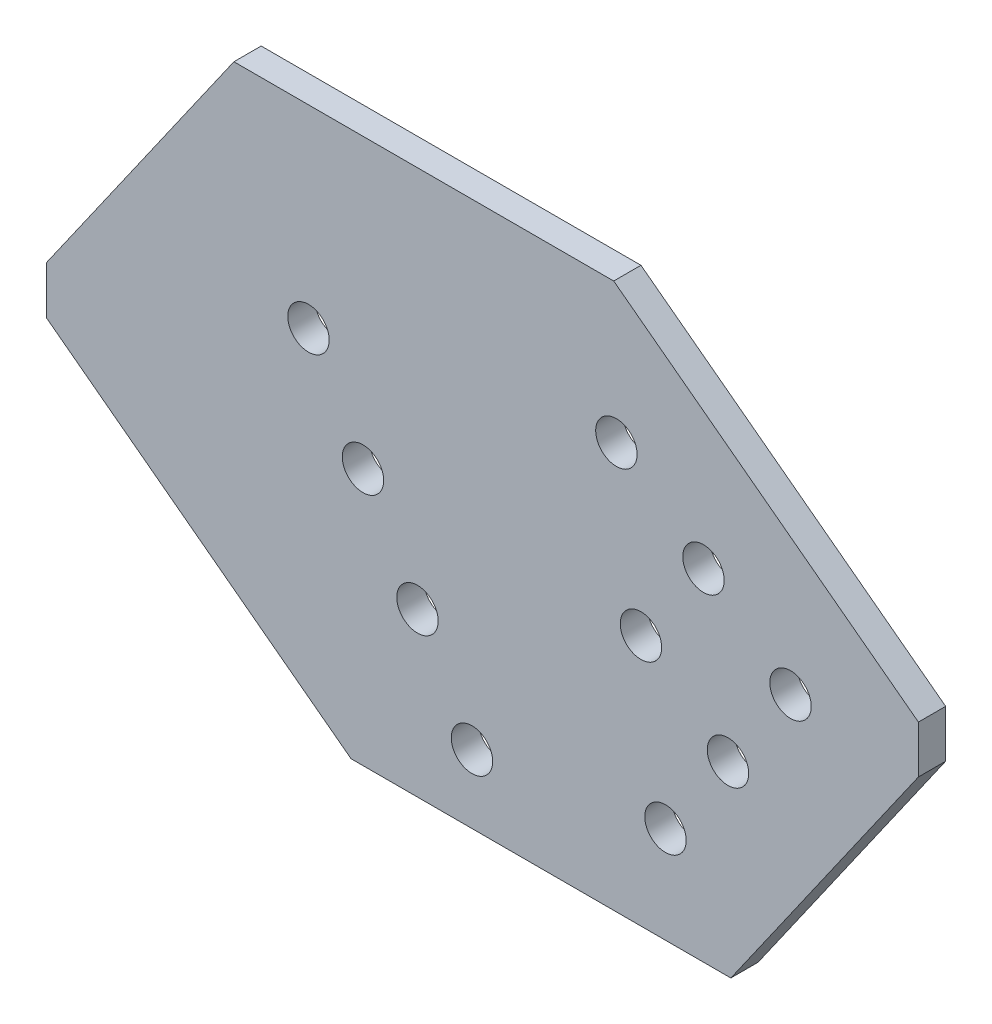
from build123d import *

# Parameters (mm, degrees)
SKETCH1_W           = 101.6
SKETCH1_H           = 63.5
BOSS_EXTRUDE1_DEPTH = 3.175
CUT_EXTRUDE1_DEPTH  = 120.85362166
CUT_EXTRUDE2_DEPTH  = 120.85362166
SKETCH4_R           = 2.413
CUT_EXTRUDE3_DEPTH  = 120.85362166
SKETCH5_R           = 2.413
CUT_EXTRUDE4_DEPTH  = 120.85362166


with BuildPart() as part:
    # Sketch1 → Boss-Extrude1 (new body)
    with BuildSketch(Plane.XY):
        with Locations((50.8, 31.75)):
            Rectangle(SKETCH1_W, SKETCH1_H)
    extrude(amount=BOSS_EXTRUDE1_DEPTH)

    # Sketch2 → Cut-Extrude1 (cut, through all)
    with BuildSketch(Plane.XY.offset(3.175)):
        Polygon((101.6, 31.209692887), (79.746737775, 0), (101.6, 0), align=None)
        Polygon((101.6, 36.749322221), (66.100651578, 63.5), (101.6, 63.5), align=None)
    extrude(amount=-CUT_EXTRUDE1_DEPTH, mode=Mode.SUBTRACT)

    # Sketch3 → Cut-Extrude2 (cut, through all)
    with BuildSketch(Plane.XY.offset(3.175)):
        Polygon((21.853262225, 63.5), (0, 32.290307113), (0, 63.5), align=None)
        Polygon((0, 0), (0, 26.750677779), (35.499348422, 0), align=None)
    extrude(amount=-CUT_EXTRUDE2_DEPTH, mode=Mode.SUBTRACT)

    # Sketch4 → Cut-Extrude3 (cut, through all)
    with BuildSketch(Plane.XY.offset(3.175)):
        with Locations((49.59148185, 7.959897775)):
            Circle(SKETCH4_R)
        with Locations((43.24148185, 18.958420404)):
            Circle(SKETCH4_R)
        with Locations((36.89148185, 29.956943032)):
            Circle(SKETCH4_R)
        with Locations((30.54148185, 40.95546566)):
            Circle(SKETCH4_R)
    extrude(amount=-CUT_EXTRUDE3_DEPTH, mode=Mode.SUBTRACT)

    # Sketch5 → Cut-Extrude4 (cut, through all)
    with BuildSketch(Plane.XY.offset(3.175)):
        with Locations((86.701417617, 32.074086458)):
            Circle(SKETCH5_R)
        with Locations((76.558746639, 39.717137252)):
            Circle(SKETCH5_R)
        with Locations((66.416075662, 47.360188046)):
            Circle(SKETCH5_R)
        with Locations((69.274325898, 29.31390629)):
            Circle(SKETCH5_R)
        with Locations((79.416996875, 21.670855495)):
            Circle(SKETCH5_R)
        with Locations((72.132576133, 11.267624533)):
            Circle(SKETCH5_R)
    extrude(amount=-CUT_EXTRUDE4_DEPTH, mode=Mode.SUBTRACT)


solid = part.part
